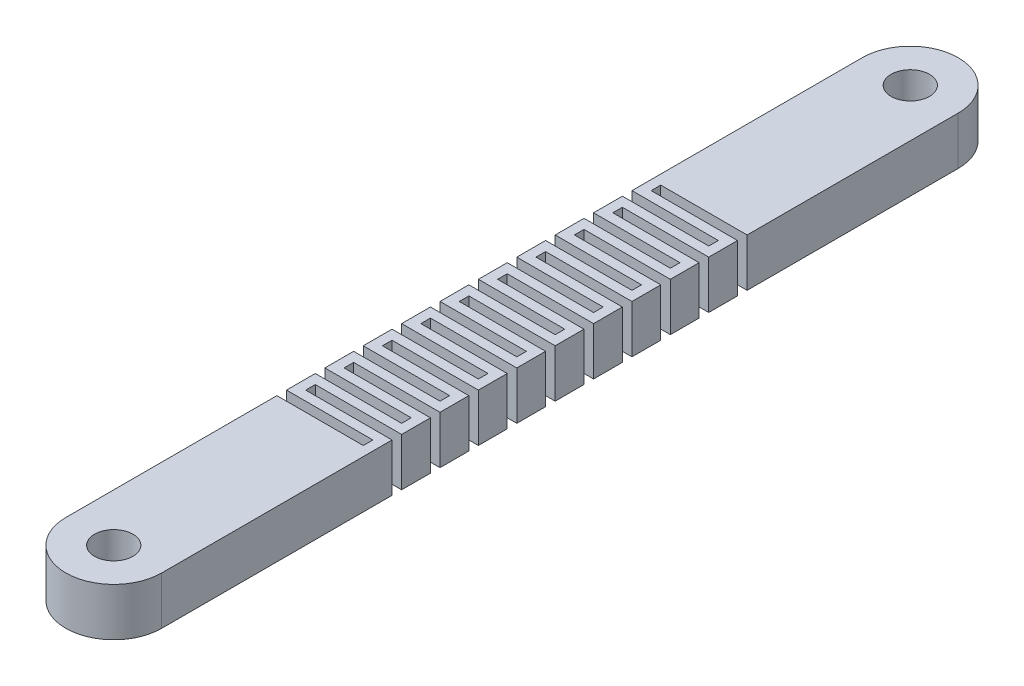
from build123d import *

# Parameters (mm, degrees)
SKETCH1_R            = 2
BOSS_EXTRUDE1_DEPTH  = 5
SKETCH2_W            = 18
SKETCH2_H            = 1
CUT_EXTRUDE1_DEPTH   = 48.03456176
LPATTERN1_COUNT      = 5
LPATTERN1_PITCH      = 4
LPATTERN1_COUNT_DIR2 = 6
LPATTERN1_PITCH_DIR2 = 4


with BuildPart() as part:
    # Sketch1 → Boss-Extrude1 (new body)
    with BuildSketch(Plane(origin=(0, 0, 0), x_dir=(1, 0, 0), z_dir=(0, 1, 0))):
        with BuildLine():
            Line((5, 41.5), (5, -41.5))
            ThreePointArc((5, -41.5), (0, -46.5), (-5, -41.5))
            Line((-5, -41.5), (-5, 41.5))
            ThreePointArc((-5, 41.5), (0, 46.5), (5, 41.5))
        make_face()
        with Locations((0, 41.5)):
            Circle(SKETCH1_R, mode=Mode.SUBTRACT)
        with Locations((0, -41.5)):
            Circle(SKETCH1_R, mode=Mode.SUBTRACT)
    extrude(amount=BOSS_EXTRUDE1_DEPTH)

    # Sketch2 → Cut-Extrude1 (cut, through all)
    with BuildSketch(Plane(origin=(0, 5, 0), x_dir=(1, 0, 0), z_dir=(0, 1, 0))):
        with Locations((5, 3)):
            Rectangle(SKETCH2_W, SKETCH2_H)
        with Locations((-5, 1)):
            Rectangle(SKETCH2_W, SKETCH2_H)
    cut_extrude1 = extrude(amount=-CUT_EXTRUDE1_DEPTH, mode=Mode.SUBTRACT)

    # LPattern1: Cut-Extrude1 5 × 6
    with Locations(*[Vector(0, 0, -1) * (i * LPATTERN1_PITCH) + Vector(0, 0, 1) * (j * LPATTERN1_PITCH_DIR2) for i in range(LPATTERN1_COUNT) for j in range(LPATTERN1_COUNT_DIR2) if (i, j) != (0, 0)]):
        add(cut_extrude1, mode=Mode.SUBTRACT)


solid = part.part
